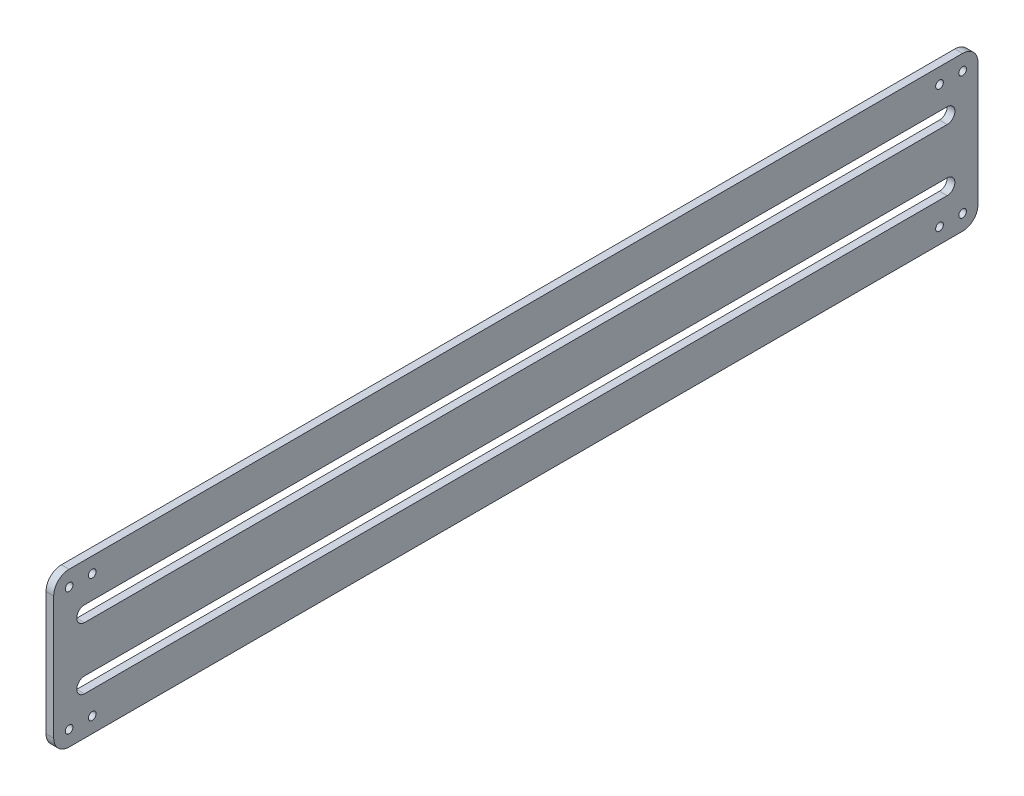
from build123d import *

# Parameters (mm, degrees)
OUTER_CUT_DEPTH   = 1.5875
SLOTS_DEPTH       = 194.153806913
SKETCH3_R         = 1.5875
MOUNT_HOLES_DEPTH = 194.153806913


with BuildPart() as part:
    # Sketch1 → Outer Cut (new, symmetric)
    with BuildSketch(Plane(origin=(0, 0, 0), x_dir=(0, 0, -1), z_dir=(1, 0, 0))):
        with BuildLine():
            Line((-184.15, -31.75), (184.15, -31.75))
            ThreePointArc((184.15, -31.75), (188.640128061, -29.890128061), (190.5, -25.4))
            Line((190.5, -25.4), (190.5, 25.4))
            ThreePointArc((190.5, 25.4), (188.640128061, 29.890128061), (184.15, 31.75))
            Line((184.15, 31.75), (-184.15, 31.75))
            ThreePointArc((-184.15, 31.75), (-188.640128061, 29.890128061), (-190.5, 25.4))
            Line((-190.5, 25.4), (-190.5, -25.4))
            ThreePointArc((-190.5, -25.4), (-188.640128061, -29.890128061), (-184.15, -31.75))
        make_face()
    extrude(amount=OUTER_CUT_DEPTH, both=True)

    # Sketch2 → Slots (cut, through all)
    with BuildSketch(Plane(origin=(1.5875, 0, 0), x_dir=(0, 0, -1), z_dir=(1, 0, 0))):
        with BuildLine():
            Line((-177.8, 15.875), (177.8, 15.875))
            ThreePointArc((177.8, 15.875), (180.975, 12.7), (177.8, 9.525))
            Line((177.8, 9.525), (-177.8, 9.525))
            ThreePointArc((-177.8, 9.525), (-180.975, 12.7), (-177.8, 15.875))
        make_face()
        with BuildLine():
            Line((-177.8, -15.875), (177.8, -15.875))
            ThreePointArc((177.8, -15.875), (180.975, -12.7), (177.8, -9.525))
            Line((177.8, -9.525), (-177.8, -9.525))
            ThreePointArc((-177.8, -9.525), (-180.975, -12.7), (-177.8, -15.875))
        make_face()
    extrude(amount=-SLOTS_DEPTH, mode=Mode.SUBTRACT)

    # Sketch3 → Mount Holes (cut, through all)
    with BuildSketch(Plane(origin=(1.5875, 0, 0), x_dir=(0, 0, -1), z_dir=(1, 0, 0))):
        with Locations((-184.15, 25.4)):
            Circle(SKETCH3_R)
        with Locations((-174.625, 25.4)):
            Circle(SKETCH3_R)
        with Locations((-174.625, -25.4)):
            Circle(SKETCH3_R)
        with Locations((-184.15, -25.4)):
            Circle(SKETCH3_R)
        with Locations((174.625, 25.4)):
            Circle(SKETCH3_R)
        with Locations((184.15, 25.4)):
            Circle(SKETCH3_R)
        with Locations((184.15, -25.4)):
            Circle(SKETCH3_R)
        with Locations((174.625, -25.4)):
            Circle(SKETCH3_R)
    extrude(amount=-MOUNT_HOLES_DEPTH, mode=Mode.SUBTRACT)


solid = part.part
